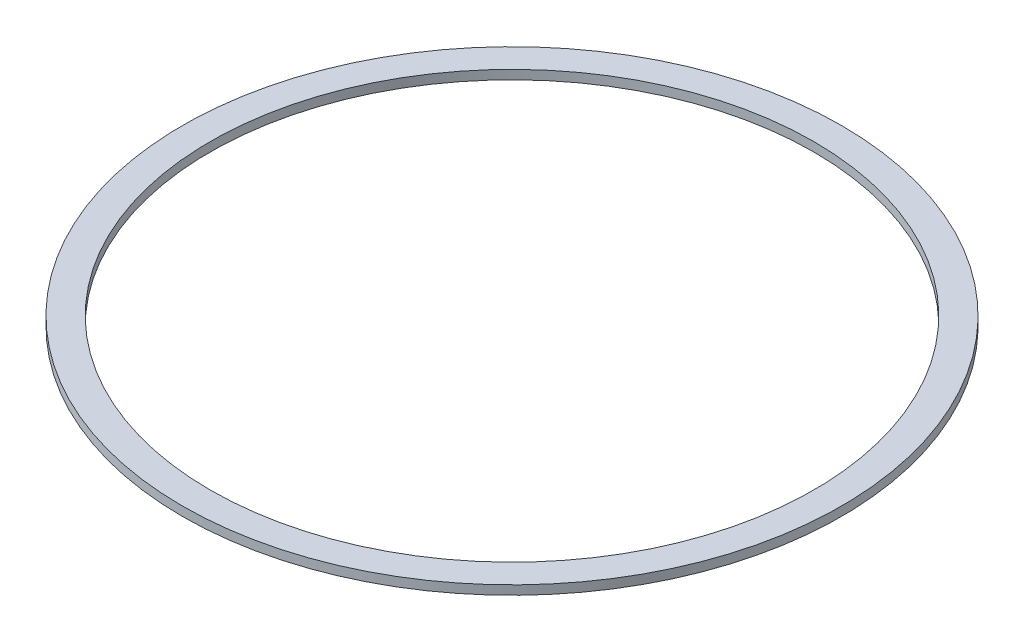
from build123d import *

# Parameters (mm, degrees)
SKETCH1_R           = 54.6
SKETCH1_R_2         = 50
BOSS_EXTRUDE1_DEPTH = 1.5


with BuildPart() as part:
    # Sketch1 → Boss-Extrude1 (new body)
    with BuildSketch(Plane(origin=(0, 0, 0), x_dir=(1, 0, 0), z_dir=(0, 1, 0))):
        Circle(SKETCH1_R)
        Circle(SKETCH1_R_2, mode=Mode.SUBTRACT)
    extrude(amount=BOSS_EXTRUDE1_DEPTH)


solid = part.part
